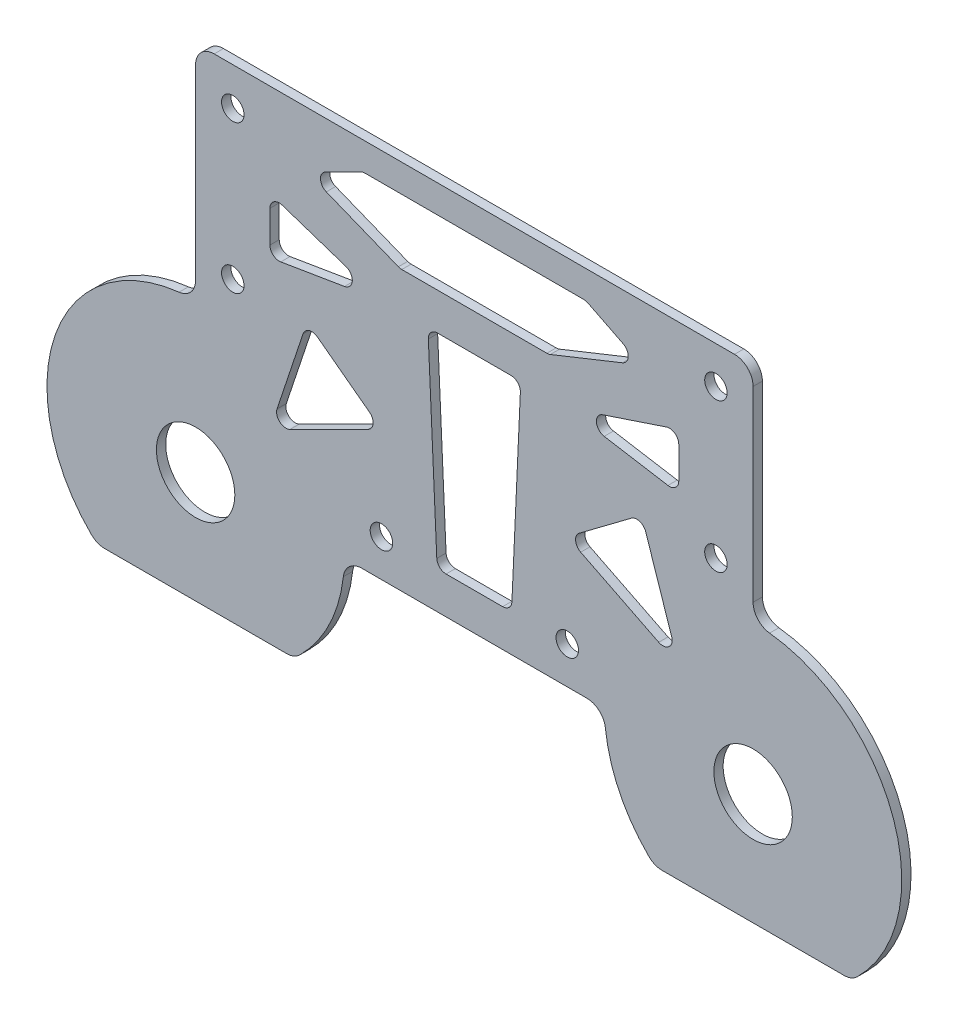
from build123d import *

# Parameters (mm, degrees)
EXTRUDE_1_OUTLINE_R = 6.05
EXTRUDE_1_DEPTH     = 5
SKETCH_3_R          = 21.1
CUT_EXTRUDE_2_DEPTH = 281.223125384
FILLET_1_R          = 10
FILLET1_R           = 10
CUT_EXTRUDE1_DEPTH  = 10
FILLET2_R           = 5


# Read off the part's stored shape, not the designer's step: 凸台-拉伸1
with BuildPart() as part:
    # 凸台-拉伸1 outline → 凸台-拉伸1 (new body)
    with BuildSketch(Plane.XY):
        with BuildLine():
            ThreePointArc((-97.084973779, -160), (-77.084973779, -132.915026221), (-70, -100))
            Line((-70, -100), (70, -100))
            ThreePointArc((70, -100), (77.084973779, -132.915026221), (97.084973779, -160))
            Line((97.084973779, -160), (202.915026221, -160))
            ThreePointArc((202.915026221, -160), (224.833147735, -71.715728753), (150, -20))
            Line((150, -20), (150, 100))
            Line((150, 100), (-150, 100))
            Line((-150, 100), (-150, -20))
            ThreePointArc((-150, -20), (-224.833147735, -71.715728753), (-202.915026221, -160))
            Line((-202.915026221, -160), (-97.084973779, -160))
        make_face()
        with Locations((-50, -80)):
            Circle(EXTRUDE_1_OUTLINE_R, mode=Mode.SUBTRACT)
        with Locations((50, -80)):
            Circle(EXTRUDE_1_OUTLINE_R, mode=Mode.SUBTRACT)
        with Locations((-130, 0)):
            Circle(EXTRUDE_1_OUTLINE_R, mode=Mode.SUBTRACT)
        with Locations((-130, 79.62392947)):
            Circle(EXTRUDE_1_OUTLINE_R, mode=Mode.SUBTRACT)
        with Locations((130, 0)):
            Circle(EXTRUDE_1_OUTLINE_R, mode=Mode.SUBTRACT)
        with Locations((130, 80)):
            Circle(EXTRUDE_1_OUTLINE_R, mode=Mode.SUBTRACT)
    extrude(amount=EXTRUDE_1_DEPTH)

    # 草图3 → 切除-拉伸2 (cut, through all)
    with BuildSketch(Plane.XY.offset(5)):
        with Locations((-150, -100)):
            Circle(SKETCH_3_R)
        with Locations((150, -100)):
            Circle(SKETCH_3_R)
    extrude(amount=-CUT_EXTRUDE_2_DEPTH, mode=Mode.SUBTRACT)

    # 圆角1
    fillet_1_edges = [part.edges().sort_by_distance(p)[0] for p in [
        (-150, -20, 2.5),
        (-150, 100, 2.5),
        (150, 100, 2.5),
        (150, -20, 2.5),
        (70, -100, 2.5),
        (-70, -100, 2.5),
    ]]
    fillet(fillet_1_edges, radius=FILLET_1_R)

    # Fillet1
    fillet1_edges = [part.edges().sort_by_distance(p)[0] for p in [
        (-97.084973779, -160, 2.5),
        (-202.915026221, -160, 2.5),
        (202.915026221, -160, 2.5),
        (97.084973779, -160, 2.5),
    ]]
    fillet(fillet1_edges, radius=FILLET1_R)

    # Sketch3 → Cut-Extrude1 (cut)
    with BuildSketch(Plane.XY.offset(5)):
        Polygon((-90, 70), (-40, 50), (40, 50), (90, 70), (60, 85), (-60, 85), align=None)
        Polygon((-110, 50), (-110, 20), (-50, 30), align=None)
        Polygon((50, 30), (110, 20), (110, 50), align=None)
        Polygon((-25, 30), (25, 30), (20, -80), (-20, -80), align=None)
        Polygon((-90, 0), (-50, -30), (-110, -60), align=None)
        Polygon((50, -30), (90, 0), (110, -60), align=None)
    extrude(amount=-CUT_EXTRUDE1_DEPTH, mode=Mode.SUBTRACT)

    # Fillet2
    fillet2_edges = [part.edges().sort_by_distance(p)[0] for p in [
        (-110, -60, 2.5),
        (-90, 0, 2.5),
        (-50, -30, 2.5),
        (50, 30, 2.5),
        (110, 50, 2.5),
        (110, 20, 2.5),
        (-110, 50, 2.5),
        (-50, 30, 2.5),
        (-110, 20, 2.5),
        (-20, -80, 2.5),
        (-25, 30, 2.5),
        (25, 30, 2.5),
        (20, -80, 2.5),
        (110, -60, 2.5),
        (50, -30, 2.5),
        (90, 0, 2.5),
        (-90, 70, 2.5),
        (-60, 85, 2.5),
        (60, 85, 2.5),
        (90, 70, 2.5),
        (40, 50, 2.5),
        (-40, 50, 2.5),
    ]]
    fillet(fillet2_edges, radius=FILLET2_R)


solid = part.part
